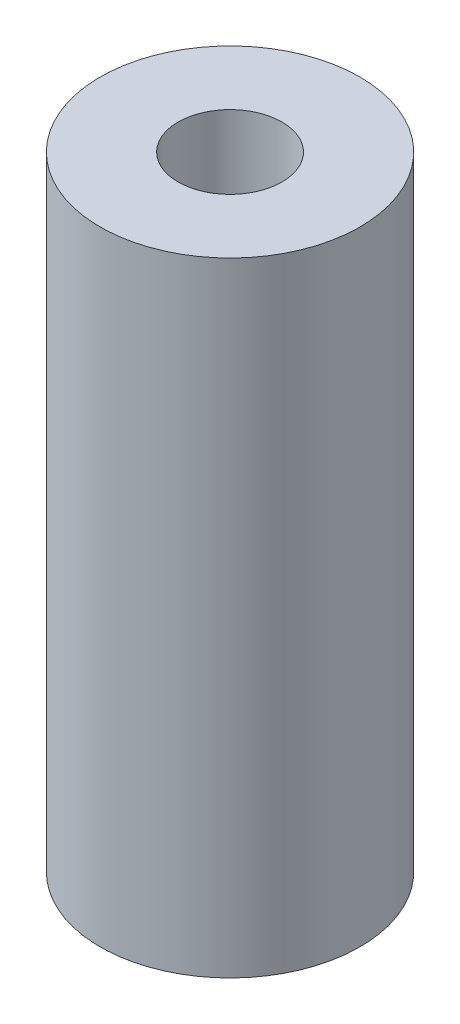
from build123d import *

# Parameters (mm, degrees)
SKETCH1_R           = 6.35
SKETCH1_R_2         = 2.54
BOSS_EXTRUDE1_DEPTH = 30.48


with BuildPart() as part:
    # Sketch1 → Boss-Extrude1 (new body)
    with BuildSketch(Plane(origin=(0, 0, 0), x_dir=(1, 0, 0), z_dir=(0, 1, 0))):
        Circle(SKETCH1_R)
        Circle(SKETCH1_R_2, mode=Mode.SUBTRACT)
    extrude(amount=BOSS_EXTRUDE1_DEPTH)


solid = part.part
